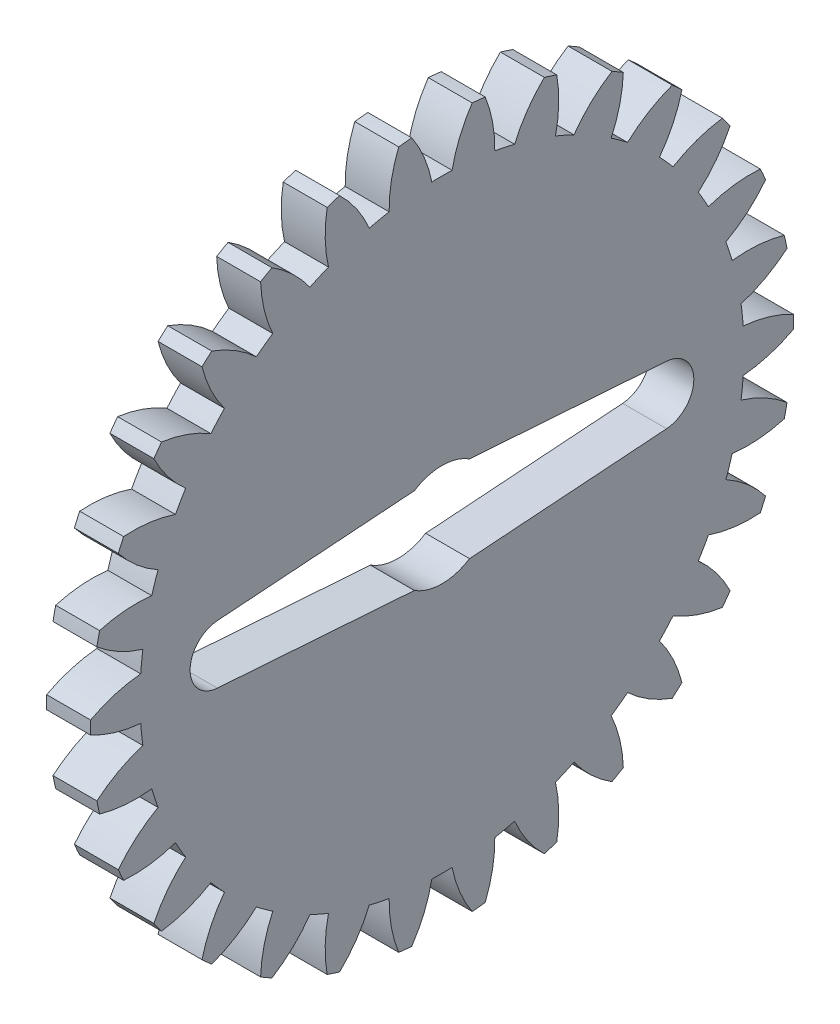
from build123d import *

# Parameters (mm, degrees)
BASPROSKE_W        = 3
BASPROSKE_H        = 24
TOOTHCUT_DEPTH     = 35.073450075
TEETHCUTS_COUNT    = 30
TEETHCUTS_ANGLE    = 348
BORSKE_R           = 2
BORE_DEPTH         = 50.001016
CUT_EXTRUDE1_DEPTH = 35.010864624


with BuildPart() as part:
    # BasProSke → Base-Revolve (revolve)
    with BuildSketch(Plane(origin=(0, 0, 0), x_dir=(1, 0, 0), z_dir=(0, 1, 0))):
        with Locations((1.5, 12)):
            Rectangle(BASPROSKE_W, BASPROSKE_H)
    revolve(axis=Axis((-10, 0, 0), (1, 0, 0)))

    # TooCutSke → ToothCut (cut, through all)
    with BuildSketch(Plane(origin=(0, 0, 0), x_dir=(0, 0, -1), z_dir=(1, 0, 0))):
        with BuildLine():
            ThreePointArc((0.693278797, 20.612344372), (0, 20.624), (-0.693278797, 20.612344372))
            ThreePointArc((-0.693278797, 20.612344372), (-1.270739341, 22.465148834), (-2.231973449, 24.151083009))
            ThreePointArc((-2.231973449, 24.151083009), (0, 24.254), (2.231973449, 24.151083009))
            ThreePointArc((2.231973449, 24.151083009), (1.270739341, 22.465148834), (0.693278797, 20.612344372))
        make_face()
    toothcut = extrude(amount=TOOTHCUT_DEPTH, mode=Mode.SUBTRACT)

    # TeethCuts: ToothCut ×30 about axis
    teethcuts_axis = Axis((-10, 0, 0), (1, 0, 0))
    for i in range(1, TEETHCUTS_COUNT):
        add(toothcut.rotate(teethcuts_axis, i * TEETHCUTS_ANGLE / (TEETHCUTS_COUNT - 1)), mode=Mode.SUBTRACT)

    # BorSke → Bore (cut, symmetric)
    with BuildSketch(Plane(origin=(0, 0, 0), x_dir=(0, 0, -1), z_dir=(1, 0, 0))):
        Circle(BORSKE_R)
    extrude(amount=BORE_DEPTH, both=True, mode=Mode.SUBTRACT)

    # Sketch2 → Cut-Extrude1 (cut, through all)
    with BuildSketch(Plane.ZY):
        with BuildLine():
            Line((-1.88348082, 2.95), (-15.34156858, 1.994983292))
            ThreePointArc((-15.34156858, 1.994983292), (-17.2, 0), (-15.34156858, -1.994983292))
            Line((-15.34156858, -1.994983292), (-1.88348082, -2.95))
            ThreePointArc((-1.88348082, -2.95), (0, -3.5), (1.88348082, -2.95))
            Line((1.88348082, -2.95), (15.34156858, -1.994983292))
            ThreePointArc((15.34156858, -1.994983292), (17.2, 0), (15.34156858, 1.994983292))
            Line((15.34156858, 1.994983292), (1.88348082, 2.95))
            ThreePointArc((1.88348082, 2.95), (0, 3.5), (-1.88348082, 2.95))
        make_face()
    extrude(amount=-CUT_EXTRUDE1_DEPTH, mode=Mode.SUBTRACT)


solid = part.part
